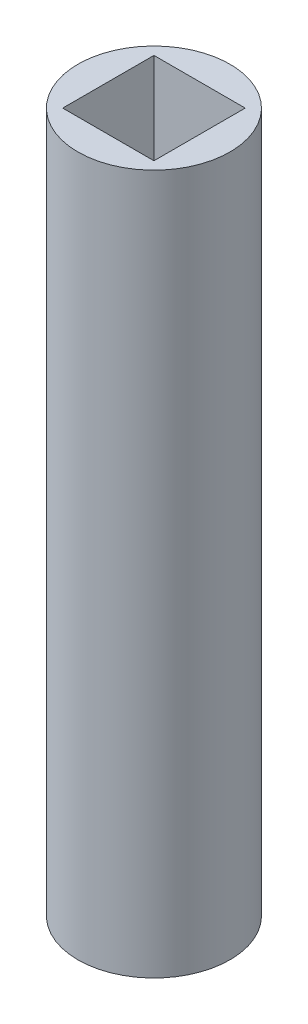
from build123d import *

# Parameters (mm, degrees)
SKETCH1_R           = 15.875
BOSS_EXTRUDE1_DEPTH = 146.05
SKETCH2_W           = 19.05
SKETCH2_H           = 19.05
CUT_EXTRUDE1_DEPTH  = 172.72


with BuildPart() as part:
    # Sketch1 → Boss-Extrude1 (new body)
    with BuildSketch(Plane(origin=(0, 0, 0), x_dir=(1, 0, 0), z_dir=(0, 1, 0))):
        Circle(SKETCH1_R)
    extrude(amount=BOSS_EXTRUDE1_DEPTH)

    # Sketch2 → Cut-Extrude1 (cut)
    with BuildSketch(Plane(origin=(0, 146.05, 0), x_dir=(1, 0, 0), z_dir=(0, 1, 0))):
        Rectangle(SKETCH2_W, SKETCH2_H)
    extrude(amount=-CUT_EXTRUDE1_DEPTH, mode=Mode.SUBTRACT)


solid = part.part
